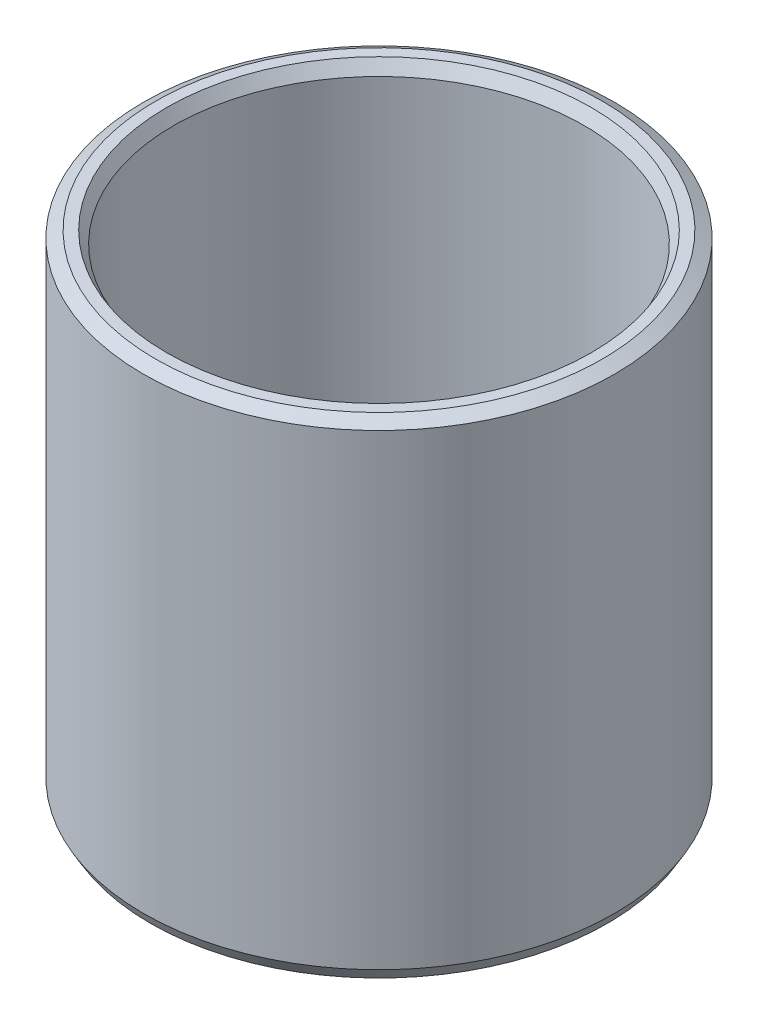
from build123d import *
from OCP.BRepFilletAPI import BRepFilletAPI_MakeChamfer

# Parameters (mm, degrees)
SKETCH1_R           = 35
BOSS_EXTRUDE1_DEPTH = 72.233988981
SKETCH2_R           = 30.51234407
CUT_EXTRUDE1_DEPTH  = 88.565684855
CHAMFER1_SIZE       = 1.042817198
CHAMFER1_SIZE2      = 1.806212369


with BuildPart() as part:
    # Sketch1 → Boss-Extrude1 (new body)
    with BuildSketch(Plane(origin=(0, 0, 0), x_dir=(1, 0, 0), z_dir=(0, 1, 0))):
        Circle(SKETCH1_R)
    extrude(amount=BOSS_EXTRUDE1_DEPTH)

    # Sketch2 → Cut-Extrude1 (cut, through all)
    with BuildSketch(Plane(origin=(0, 0, 0), x_dir=(1, 0, 0), z_dir=(0, 1, 0))):
        Circle(SKETCH2_R)
    extrude(amount=CUT_EXTRUDE1_DEPTH, mode=Mode.SUBTRACT)

    # Chamfer1: one chamfer whose edges measure the first distance from different faces: ONE call of the kernel's chamfer builder (chamfer() names one face for all edges)
    chamfer1_edges_1 = [part.edges().sort_by_distance(p)[0] for p in [
        (-30.51234407, 72.233988981, 0),
    ]]
    chamfer1_side_1 = [part.faces().sort_by_distance(p)[0] for p in [
        (-34.010050506, 72.233988981, 0),
    ]]
    chamfer1_edges_2 = [part.edges().sort_by_distance(p)[0] for p in [
        (-30.51234407, 0, 0),
    ]]
    chamfer1_side_2 = [part.faces().sort_by_distance(p)[0] for p in [
        (-30.51234407, 36.11699449, 0),
    ]]
    chamfer1_edges_3 = [part.edges().sort_by_distance(p)[0] for p in [
        (-35, 0, 0),
    ]]
    chamfer1_side_3 = [part.faces().sort_by_distance(p)[0] for p in [
        (-34.010050506, 0, 0),
    ]]
    chamfer1_edges_4 = [part.edges().sort_by_distance(p)[0] for p in [
        (-35, 72.233988981, 0),
    ]]
    chamfer1_side_4 = [part.faces().sort_by_distance(p)[0] for p in [
        (-35, 36.11699449, 0),
    ]]
    chamfer1 = BRepFilletAPI_MakeChamfer(part.part.solid().wrapped)
    for e in chamfer1_edges_1:
        chamfer1.Add(CHAMFER1_SIZE, CHAMFER1_SIZE2, e.wrapped, chamfer1_side_1[0].wrapped)  # the first distance lies on this face
    for e in chamfer1_edges_2:
        chamfer1.Add(CHAMFER1_SIZE, CHAMFER1_SIZE2, e.wrapped, chamfer1_side_2[0].wrapped)  # the first distance lies on this face
    for e in chamfer1_edges_3:
        chamfer1.Add(CHAMFER1_SIZE, CHAMFER1_SIZE2, e.wrapped, chamfer1_side_3[0].wrapped)  # the first distance lies on this face
    for e in chamfer1_edges_4:
        chamfer1.Add(CHAMFER1_SIZE, CHAMFER1_SIZE2, e.wrapped, chamfer1_side_4[0].wrapped)  # the first distance lies on this face
    add(Compound.cast(chamfer1.Shape()), mode=Mode.REPLACE)


solid = part.part
